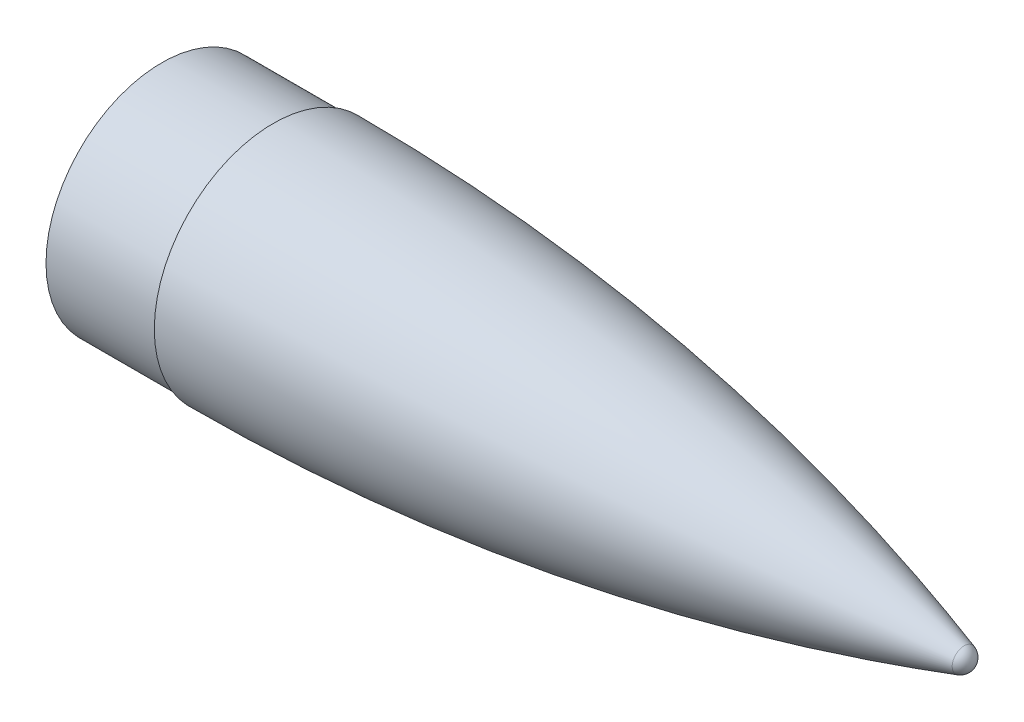
from build123d import *


with BuildPart() as part:
    # 草圖2 → 旋轉1 (revolve)
    with BuildSketch(Plane.XY):
        with BuildLine():
            ThreePointArc((-6.974901043, 9.531462443), (-279.597649208, 73.506236643), (-558.8, 95))
            Line((-558.8, 95), (-558.8, 92.5))
            Line((-558.8, 92.5), (-647.8, 92.5))
            Line((-647.8, 92.5), (-647.8, 80))
            Line((-647.8, 80), (-558.8, 80))
            Line((-558.8, 80), (-558.8, 85))
            ThreePointArc((-558.8, 85), (-281.12823334, 63.624065211), (-10, 0))
            Line((-10, 0), (0, 0))
            ThreePointArc((0, 0), (-1.929963148, 5.905464013), (-6.974901043, 9.531462443))
        make_face()
    revolve(axis=Axis((-711, 0, 0), (1, 0, 0)))


solid = part.part
